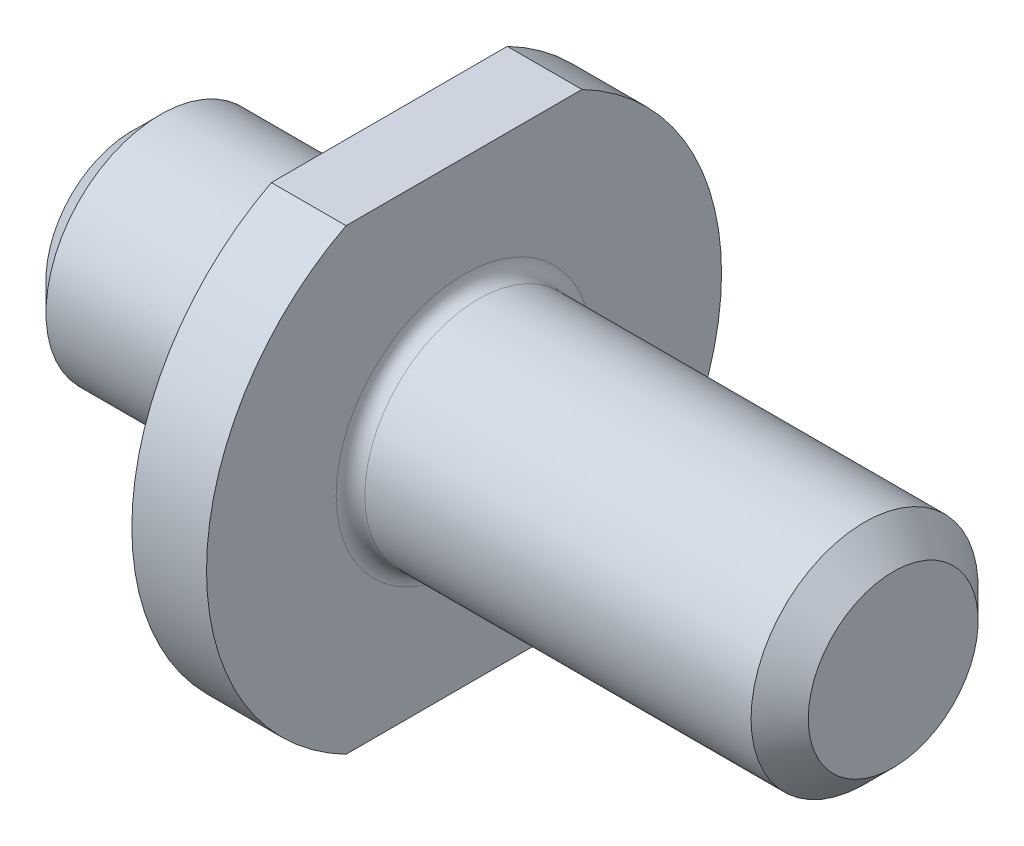
from build123d import *

# Parameters (mm, degrees)
CHAMFER1_SIZE           = 1
FILLET1_R               = 0.5
CUT_EXTRUDE1_DEPTH      = 22.72814074
CUT_EXTRUDE1_DEPTH_BACK = 22.72814074
SKETCH2_OUTSIDE_W       = 27.366
SKETCH2_OUTSIDE_H       = 27.366
SKETCH2_OUTSIDE_W_2     = 26.756004186
SKETCH2_OUTSIDE_H_2     = 16


with BuildPart() as part:
    # Sketch1 → Revolve1 (revolve)
    with BuildSketch(Plane.XY):
        Polygon((0, 4), (0, 9), (2.61, 9), (2.61, 3.96875), (17.61, 3.96875), (17.61, 0), (-9, 0), (-9, 4), align=None)
    revolve(axis=Axis((-38.174026976, 0, 0), (1, 0, 0)))

    # Chamfer1
    chamfer1_edges = [part.edges().sort_by_distance(p)[0] for p in [
        (17.61, -3.96875, 0),
        (-9, -4, 0),
    ]]
    chamfer(chamfer1_edges, length=CHAMFER1_SIZE)

    # Fillet1
    fillet1_edges = [part.edges().sort_by_distance(p)[0] for p in [
        (2.61, -3.96875, 0),
        (0, -4, 0),
    ]]
    fillet(fillet1_edges, radius=FILLET1_R)

    # Sketch2 outside → Cut-Extrude1 (cut, two sides: drawn at the far end of the back side and taken through both)
    with BuildSketch(Plane(origin=(0, 0, 0), x_dir=(0, 0, -1), z_dir=(1, 0, 0)).offset(-CUT_EXTRUDE1_DEPTH_BACK)):
        Rectangle(SKETCH2_OUTSIDE_W, SKETCH2_OUTSIDE_H)
        Rectangle(SKETCH2_OUTSIDE_W_2, SKETCH2_OUTSIDE_H_2, mode=Mode.SUBTRACT)
    extrude(amount=CUT_EXTRUDE1_DEPTH + CUT_EXTRUDE1_DEPTH_BACK, mode=Mode.SUBTRACT)


solid = part.part
